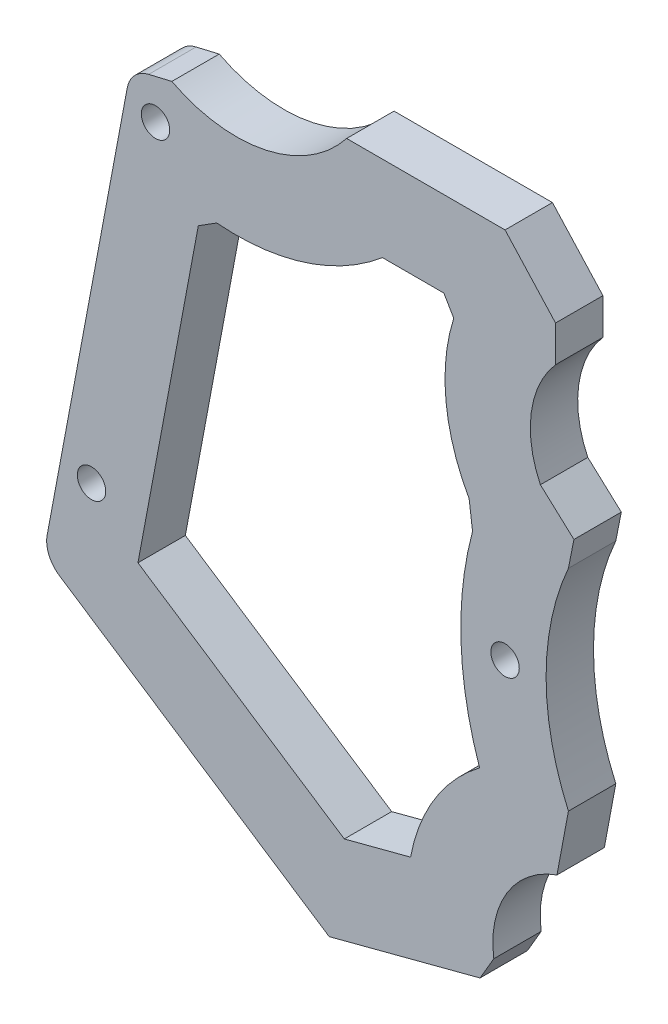
from build123d import *

# Parameters (mm, degrees)
SKETCH2_R           = 1.5
BOSS_EXTRUDE1_DEPTH = 5
FILLET1_R           = 3
CHAMFER3_SIZE       = 2


with BuildPart() as part:
    # Sketch2 → Boss-Extrude1 (new body)
    with BuildSketch(Plane.XY.offset(-29.5)):
        with BuildLine():
            Line((-2.624619354, 3.548914368), (-11.801237054, -45.426295313))
            Line((-11.801237054, -45.426295313), (18.322008005, -65.275718381))
            Line((18.322008005, -65.275718381), (36.176514182, -60.587663687))
            ThreePointArc((36.176514182, -60.587663687), (36.583090059, -52.82338526), (42.360756545, -47.620703893))
            Line((42.360756545, -47.620703893), (43.567071105, -41.182655532))
            ThreePointArc((43.567071105, -41.182655532), (41.213039161, -30.088151018), (43.567071105, -18.993646503))
            Line((43.567071105, -18.993646503), (44.148406248, -16.06786198))
            Line((44.148406248, -16.06786198), (40.610484334, -12.837581299))
            ThreePointArc((40.610484334, -12.837581299), (39.645613087, -6.714468603), (42.210497415, -1.071344115))
            Line((42.210497415, -1.071344115), (42.210497415, 2.742539662))
            Line((42.210497415, 2.742539662), (36.882012848, 8.585085022))
            Line((36.882012848, 8.585085022), (20.167337536, 8.585085022))
            ThreePointArc((20.167337536, 8.585085022), (11.667192324, 3.260597998), (1.723711062, 4.575820826))
            Line((1.723711062, 4.575820826), (-2.624619354, 3.548914368))
        make_face()
        Circle(SKETCH2_R, mode=Mode.SUBTRACT)
        with Locations((36.882012848, -30.719979302)):
            Circle(SKETCH2_R, mode=Mode.SUBTRACT)
        with Locations((-6.752606997, -36.378596712)):
            Circle(SKETCH2_R, mode=Mode.SUBTRACT)
        with BuildLine():
            Line((-1.853309264, -41.203149553), (19.920649662, -55.5508907))
            Line((19.920649662, -55.5508907), (26.912648631, -53.715002702))
            ThreePointArc((26.912648631, -53.715002702), (29.448505151, -47.134631862), (34.193378933, -41.917542493))
            ThreePointArc((34.193378933, -41.917542493), (32.235117961, -31.354391616), (33.452553096, -20.680461028))
            Line((33.452553096, -20.680461028), (33.092400062, -17.875614172))
            ThreePointArc((33.092400062, -17.875614172), (30.652450166, -10.205517854), (31.469259091, -2.198236405))
            Line((31.469259091, -2.198236405), (30.430492401, -0.414914978))
            Line((30.430492401, -0.414914978), (23.934260151, -0.414914978))
            ThreePointArc((23.934260151, -0.414914978), (15.757383222, -4.951165755), (6.464186316, -5.988170424))
            Line((6.464186316, -5.988170424), (4.514445223, -7.21872072))
            Line((4.514445223, -7.21872072), (-1.853309264, -41.203149553))
        make_face(mode=Mode.SUBTRACT)
    extrude(amount=BOSS_EXTRUDE1_DEPTH)

    # Fillet1
    fillet1_edges = [part.edges().sort_by_distance(p)[0] for p in [
        (-11.801237054, -45.426295313, -27),
        (-2.624619354, 3.548914368, -27),
    ]]
    fillet(fillet1_edges, radius=FILLET1_R)

    # Chamfer3
    # the kernel refuses this chamfer: 2, 1.851821387 mm, written as the material it takes off along each edge
    with BuildSketch(Plane(origin=(36.176514182, -60.587663687, -34.731164248), x_dir=(-0.9672143762553561, -0.25396131667039873, 0), z_dir=(0, 0, 1))) as chamfer3_piece_1:
        with BuildLine():
            Line((CHAMFER3_SIZE, 0), (-0.03393884, -2.03393884))
            ThreePointArc((-0.03393884, -2.03393884), (0.03354605, -1.046793416), (0, 0))
            Line((0, 0), (CHAMFER3_SIZE, 0))
        make_face()
    extrude(amount=15.462328496, mode=Mode.SUBTRACT)


solid = part.part
